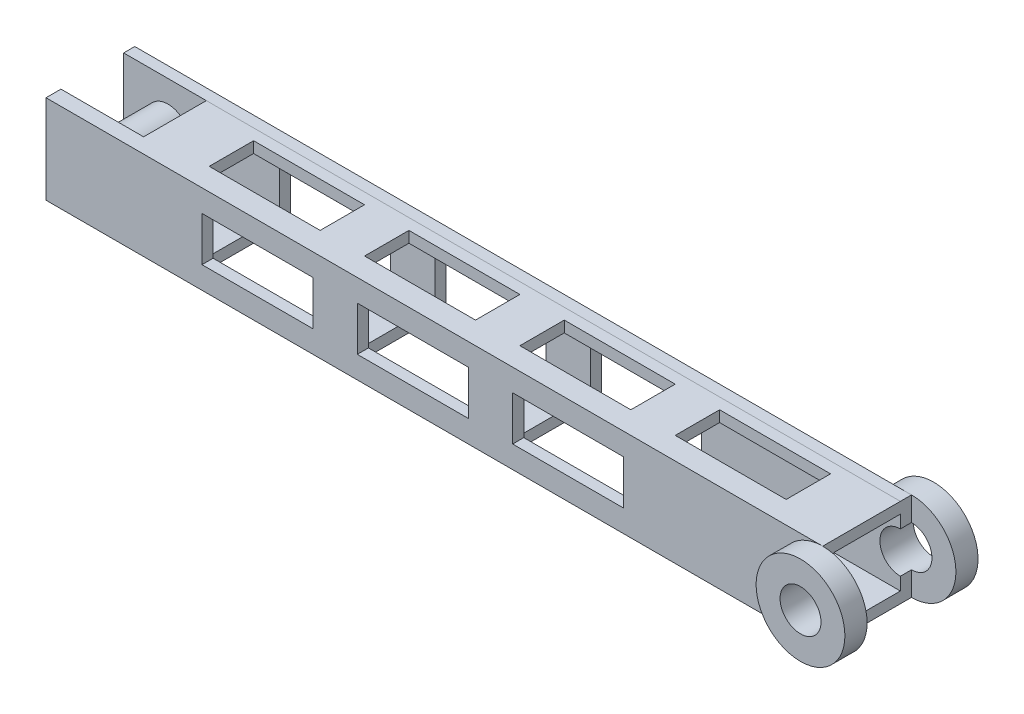
from build123d import *

# Parameters (mm, degrees)
SKETCH1_W               = 350
SKETCH1_H               = 40
BOSS_EXTRUDE1_DEPTH     = 5
SKETCH2_W               = 350
SKETCH2_H               = 5
BOSS_EXTRUDE2_DEPTH     = 30
SKETCH3_W               = 350
SKETCH3_H               = 5
BOSS_EXTRUDE3_DEPTH     = 30
SKETCH5_W               = 350
SKETCH5_H               = 40.001168566
BOSS_EXTRUDE4_DEPTH     = 5
CUT_EXTRUDE1_DEPTH      = 246.966328414
CUT_EXTRUDE1_DEPTH_BACK = 246.966328414
SKETCH7_W               = 50
SKETCH7_H               = 20
CUT_EXTRUDE2_DEPTH      = 248.435367346
CUT_EXTRUDE2_DEPTH_BACK = 248.435367346
SKETCH8_W               = 50
SKETCH8_H               = 20
SKETCH9_R               = 20
BOSS_EXTRUDE5_DEPTH     = 10
BOSS_EXTRUDE6_START     = 10
SKETCH10_R              = 20
BOSS_EXTRUDE6_DEPTH     = 10
SKETCH11_W              = 37.254002163
SKETCH11_H              = 28.263435051
CUT_EXTRUDE3_DEPTH      = 269.625284498
CUT_EXTRUDE4_DEPTH      = 270.32270081
CUT_EXTRUDE4_DEPTH_BACK = 270.32270081
SKETCH12_R              = 9.224826447
SKETCH13_R              = 10
BOSS_EXTRUDE7_DEPTH     = 40


with BuildPart() as part:
    # Sketch1 → Boss-Extrude1 (new body)
    with BuildSketch(Plane.XY):
        with Locations((65.882061447, 9.583746283)):
            Rectangle(SKETCH1_W, SKETCH1_H)
    extrude(amount=BOSS_EXTRUDE1_DEPTH)

    # Sketch2 → Boss-Extrude2 (add)
    with BuildSketch(Plane.XY.offset(5)):
        with Locations((65.882061447, 27.084914849)):
            Rectangle(SKETCH2_W, SKETCH2_H)
    extrude(amount=BOSS_EXTRUDE2_DEPTH)

    # Sketch3 → Boss-Extrude3 (add)
    with BuildSketch(Plane.XY.offset(5)):
        with Locations((65.882061447, -7.916253717)):
            Rectangle(SKETCH3_W, SKETCH3_H)
    extrude(amount=BOSS_EXTRUDE3_DEPTH)

    # Sketch5 → Boss-Extrude4 (add)
    with BuildSketch(Plane.XY.offset(35)):
        with Locations((65.882061447, 9.584330566)):
            Rectangle(SKETCH5_W, SKETCH5_H)
    extrude(amount=BOSS_EXTRUDE4_DEPTH)

    # Sketch7 → Cut-Extrude1 (cut, two sides: drawn at the far end of the back side and taken through both)
    with BuildSketch(Plane.XY.offset(40).offset(-CUT_EXTRUDE1_DEPTH_BACK)):
        with Locations((-13.828244269, 9.583746283)):
            Rectangle(SKETCH7_W, SKETCH7_H)
        with Locations((56.171755731, 9.583746283)):
            Rectangle(SKETCH7_W, SKETCH7_H)
        with Locations((126.171755731, 9.583746283)):
            Rectangle(SKETCH7_W, SKETCH7_H)
    extrude(amount=CUT_EXTRUDE1_DEPTH + CUT_EXTRUDE1_DEPTH_BACK, mode=Mode.SUBTRACT)

    # Sketch8 → Cut-Extrude2 (cut, two sides: drawn at the far end of the back side and taken through both)
    with BuildSketch(Plane(origin=(0, 29.584914849, 0), x_dir=(1, 0, 0), z_dir=(0, 1, 0)).offset(-CUT_EXTRUDE2_DEPTH_BACK)):
        with Locations((-20.575444154, -20)):
            Rectangle(SKETCH8_W, SKETCH8_H)
        with Locations((49.424555846, -20)):
            Rectangle(SKETCH8_W, SKETCH8_H)
        with Locations((119.424555846, -20)):
            Rectangle(SKETCH8_W, SKETCH8_H)
        with Locations((189.424555846, -20)):
            Rectangle(SKETCH8_W, SKETCH8_H)
    extrude(amount=CUT_EXTRUDE2_DEPTH + CUT_EXTRUDE2_DEPTH_BACK, mode=Mode.SUBTRACT)

    # Sketch9 → Boss-Extrude5 (add)
    with BuildSketch(Plane.XY.offset(40)):
        with Locations((240.882061447, 9.584330566)):
            Circle(SKETCH9_R)
    extrude(amount=BOSS_EXTRUDE5_DEPTH)

    # Sketch10 → Boss-Extrude6 (add)
    with BuildSketch(Plane(origin=(0, 0, 0), x_dir=(-1, 0, 0), z_dir=(0, 0, -1)).offset(BOSS_EXTRUDE6_START)):
        with Locations((-240.882061447, 9.584330566)):
            Circle(SKETCH10_R)
    extrude(amount=-BOSS_EXTRUDE6_DEPTH)

    # Sketch11 → Cut-Extrude3 (cut, through all)
    with BuildSketch(Plane(origin=(0, 29.584914849, 0), x_dir=(1, 0, 0), z_dir=(0, 1, 0))):
        with Locations((-90.490937472, -19.131717526)):
            Rectangle(SKETCH11_W, SKETCH11_H)
    extrude(amount=-CUT_EXTRUDE3_DEPTH, mode=Mode.SUBTRACT)

    # Sketch12 → Cut-Extrude4 (cut, two sides: drawn at the far end of the back side and taken through both)
    with BuildSketch(Plane.XY.offset(50).offset(-CUT_EXTRUDE4_DEPTH_BACK)):
        with Locations((240.882061447, 9.584330566)):
            Circle(SKETCH12_R)
    extrude(amount=CUT_EXTRUDE4_DEPTH + CUT_EXTRUDE4_DEPTH_BACK, mode=Mode.SUBTRACT)

    # Sketch13 → Boss-Extrude7 (add)
    with BuildSketch(Plane.XY.offset(40)):
        with Locations((-89.117938553, 9.583746283)):
            Circle(SKETCH13_R)
    extrude(amount=-BOSS_EXTRUDE7_DEPTH)


solid = part.part
